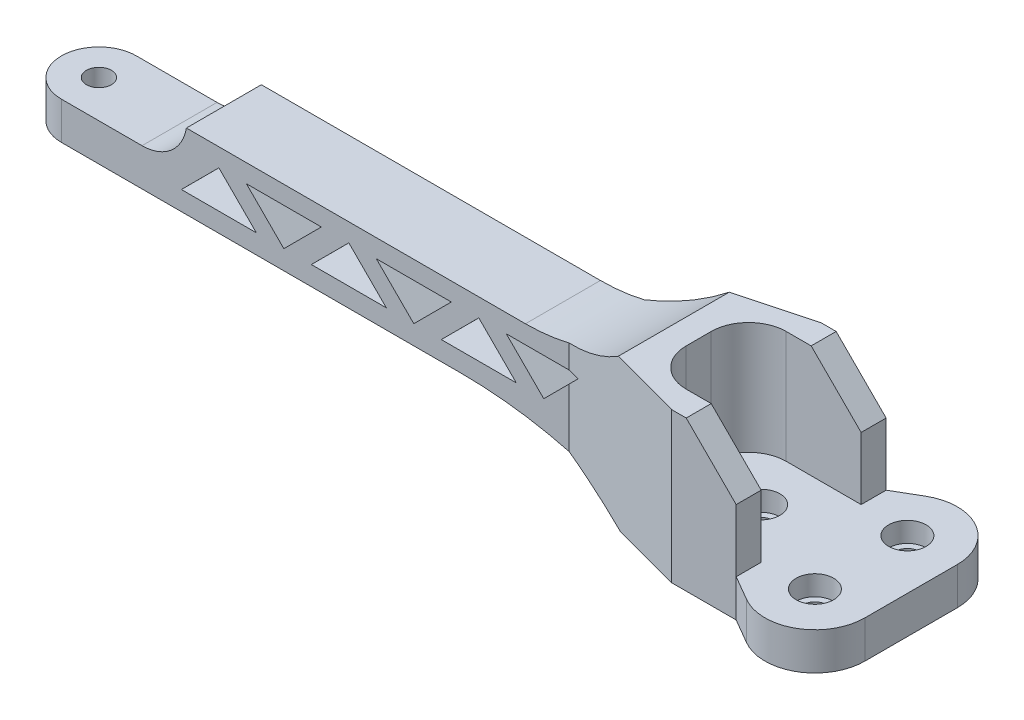
from build123d import *

# Parameters (mm, degrees)
BOSS_EXTRUDE1_DEPTH                     = 15
BOSS_EXTRUDE1_DEPTH_BACK                = 15
FILLET1_R                               = 15
BOSS_EXTRUDE2_DEPTH                     = 60
CUT_EXTRUDE5_DEPTH                      = 43
CUT_EXTRUDE5_DEPTH_BACK                 = 43
SKETCH1_6_OUTSIDE_W                     = 364.354
SKETCH1_6_OUTSIDE_H                     = 124.354
BOSS_EXTRUDE3_DEPTH                     = 15
CUT_EXTRUDE7_DEPTH                      = 256.415087263
CBORE_FOR_M5_HEX_HEAD_BOLT1_D           = 10
CBORE_FOR_M5_HEX_HEAD_BOLT1_DEPTH       = 20
CBORE_FOR_M5_HEX_HEAD_BOLT1_CBORE_D     = 15
CBORE_FOR_M5_HEX_HEAD_BOLT1_CBORE_DEPTH = 8
CBORE_FOR_M5_HEX_HEAD_BOLT1_TIP         = 3.004303095
F_10_0MM_DOWEL_HOLE1_D                  = 10
CUT_EXTRUDE9_DEPTH                      = 259.016066246
CUT_EXTRUDE14_DEPTH                     = 259.016066246


with BuildPart() as part:
    # Sketch1 → Boss-Extrude1 (new, two sides: drawn at the far end of the back side and taken through both)
    with BuildSketch(Plane.XY.offset(-BOSS_EXTRUDE1_DEPTH_BACK)):
        with BuildLine():
            Line((0, 0), (-91.545543809, 0))
            Line((-91.545543809, 0), (-91.545543809, 15))
            Line((-91.545543809, 15), (-44.293783158, 15))
            ThreePointArc((-44.293783158, 15), (-32.674833119, 19.252272915), (-26.545543809, 30))
            Line((-26.545543809, 30), (109.126292876, 30))
            ThreePointArc((109.126292876, 30), (132.446309196, 33.71762603), (153.454456191, 44.501950965))
            Line((153.454456191, 44.501950965), (188.454456191, 44.501950965))
            Line((188.454456191, 44.501950965), (208.454456191, 24.501950965))
            Line((208.454456191, 24.501950965), (208.454456191, 0))
            Line((208.454456191, 0), (208.454456191, -15.498049035))
            Line((208.454456191, -15.498049035), (154.553796185, -15.498049035))
            ThreePointArc((154.553796185, -15.498049035), (119.809900794, -3.919403897), (83.397793421, 0))
            Line((83.397793421, 0), (0, 0))
        make_face()
    extrude(amount=BOSS_EXTRUDE1_DEPTH + BOSS_EXTRUDE1_DEPTH_BACK)

    # Fillet1
    fillet1_edges = [part.edges().sort_by_distance(p)[0] for p in [
        (-91.545543809, 7.5, 15),
        (-91.545543809, 7.5, -15),
    ]]
    fillet(fillet1_edges, radius=FILLET1_R - 0.0001)  # a hair under: the kernel refuses the full size

    # Sketch2 → Boss-Extrude2 (add)
    with BuildSketch(Plane.XZ.offset(15.498049035)):
        Polygon((126.618755864, -15), (153.454456191, -22.190604231), (182.599517977, -30), (208.454456191, -30), (208.454456191, 30), (182.599517977, 30), (153.454456191, 22.190604231), (126.618755864, 15), align=None)
    extrude(amount=-BOSS_EXTRUDE2_DEPTH)

    # Sketch1<6> outside → Cut-Extrude5 (cut, two sides: drawn at the far end of the back side and taken through both)
    with BuildSketch(Plane.XY.offset(-CUT_EXTRUDE5_DEPTH_BACK)):
        with Locations((58.454, 14.502)):
            Rectangle(SKETCH1_6_OUTSIDE_W, SKETCH1_6_OUTSIDE_H)
        with BuildLine():
            Line((0, 0), (-91.545543809, 0))
            Line((-91.545543809, 0), (-91.545543809, 15))
            Line((-91.545543809, 15), (-44.293783158, 15))
            ThreePointArc((-44.293783158, 15), (-32.674833119, 19.252272915), (-26.545543809, 30))
            Line((-26.545543809, 30), (109.126292876, 30))
            ThreePointArc((109.126292876, 30), (132.446309196, 33.71762603), (153.454456191, 44.501950965))
            Line((153.454456191, 44.501950965), (188.454456191, 44.501950965))
            Line((188.454456191, 44.501950965), (208.454456191, 24.501950965))
            Line((208.454456191, 24.501950965), (208.454456191, 0))
            Line((208.454456191, 0), (208.454456191, -15.498049035))
            Line((208.454456191, -15.498049035), (154.553796185, -15.498049035))
            ThreePointArc((154.553796185, -15.498049035), (119.809900794, -3.919403897), (83.397793421, 0))
            Line((83.397793421, 0), (0, 0))
        make_face(mode=Mode.SUBTRACT)
    extrude(amount=CUT_EXTRUDE5_DEPTH + CUT_EXTRUDE5_DEPTH_BACK, mode=Mode.SUBTRACT)

    # Sketch3 → Boss-Extrude3 (add)
    with BuildSketch(Plane.XZ.offset(15.498049035)):
        with BuildLine():
            Line((208.454456191, -30), (218.39339466, -35.78511038))
            ThreePointArc((218.39339466, -35.78511038), (238.423878677, -35.838126061), (248.454456191, -18.5))
            Line((248.454456191, -18.5), (248.454456191, 18.5))
            ThreePointArc((248.454456191, 18.5), (238.423878677, 35.838126061), (218.39339466, 35.78511038))
            Line((218.39339466, 35.78511038), (208.454456191, 30))
            Line((208.454456191, 30), (208.454456191, -30))
        make_face()
    extrude(amount=-BOSS_EXTRUDE3_DEPTH)

    # Sketch4 → Cut-Extrude7 (cut, through all)
    with BuildSketch(Plane(origin=(0, -0.498049035, 0), x_dir=(1, 0, 0), z_dir=(0, 1, 0))):
        with BuildLine():
            Line((208.454456191, 20), (178.454456191, 20))
            ThreePointArc((178.454456191, 20), (167.847854474, 15.606601718), (163.454456191, 5))
            Line((163.454456191, 5), (163.454456191, -5))
            ThreePointArc((163.454456191, -5), (167.847854474, -15.606601718), (178.454456191, -20))
            Line((178.454456191, -20), (208.454456191, -20))
            Line((208.454456191, -20), (208.454456191, 20))
        make_face()
    extrude(amount=CUT_EXTRUDE7_DEPTH, mode=Mode.SUBTRACT)

    # CBORE for M5 Hex Head Bolt1
    with Locations(Plane(origin=(0, -0.498049035, 0), x_dir=(1, 0, 0), z_dir=(0, 1, 0))):
        with Locations((188.454456191, 0), (228.454456191, 18.5), (228.454456191, -18.5)):
            CounterBoreHole(CBORE_FOR_M5_HEX_HEAD_BOLT1_D / 2, CBORE_FOR_M5_HEX_HEAD_BOLT1_CBORE_D / 2, CBORE_FOR_M5_HEX_HEAD_BOLT1_CBORE_DEPTH, depth=CBORE_FOR_M5_HEX_HEAD_BOLT1_DEPTH)
            with Locations((0, 0, -(CBORE_FOR_M5_HEX_HEAD_BOLT1_DEPTH + CBORE_FOR_M5_HEX_HEAD_BOLT1_TIP / 2))):  # 118° drill point
                Cone(0, CBORE_FOR_M5_HEX_HEAD_BOLT1_D / 2, CBORE_FOR_M5_HEX_HEAD_BOLT1_TIP, mode=Mode.SUBTRACT)

    # Ø10.0mm Dowel Hole1 (through all)
    with Locations(Plane(origin=(0, 15, 0), x_dir=(1, 0, 0), z_dir=(0, 1, 0))):
        with Locations((-76.545543809, 0)):
            Hole(F_10_0MM_DOWEL_HOLE1_D / 2)

    # Sketch14 → Cut-Extrude9 (cut, through all)
    with BuildSketch(Plane.XY.offset(15)):
        Polygon((-28.545543809, 7.687067678), (-13.545543809, 22.704940786), (1.454456191, 7.687067678), align=None)
        Polygon((12.454456191, 7.687067678), (-2.545543809, 22.704940786), (27.454456191, 22.704940786), align=None)
        Polygon((49.454456191, 22.704940786), (79.454456191, 22.704940786), (64.454456191, 7.687067678), align=None)
        Polygon((23.454456191, 7.687067678), (38.454456191, 22.704940786), (53.454456191, 7.687067678), align=None)
        Polygon((75.454456191, 7.687067678), (90.454456191, 22.704940786), (105.454456191, 7.687067678), align=None)
        Polygon((116.454456191, 7.687067678), (101.454456191, 22.704940786), (131.454456191, 22.704940786), align=None)
    extrude(amount=-CUT_EXTRUDE9_DEPTH, mode=Mode.SUBTRACT)

    # Sketch14<3> → Cut-Extrude14 (cut, through all)
    with BuildSketch(Plane.XY.offset(15)):
        Polygon((116.454456191, 7.687067678), (101.454456191, 22.704940786), (131.454456191, 22.704940786), align=None)
    extrude(amount=CUT_EXTRUDE14_DEPTH, mode=Mode.SUBTRACT)


solid = part.part
